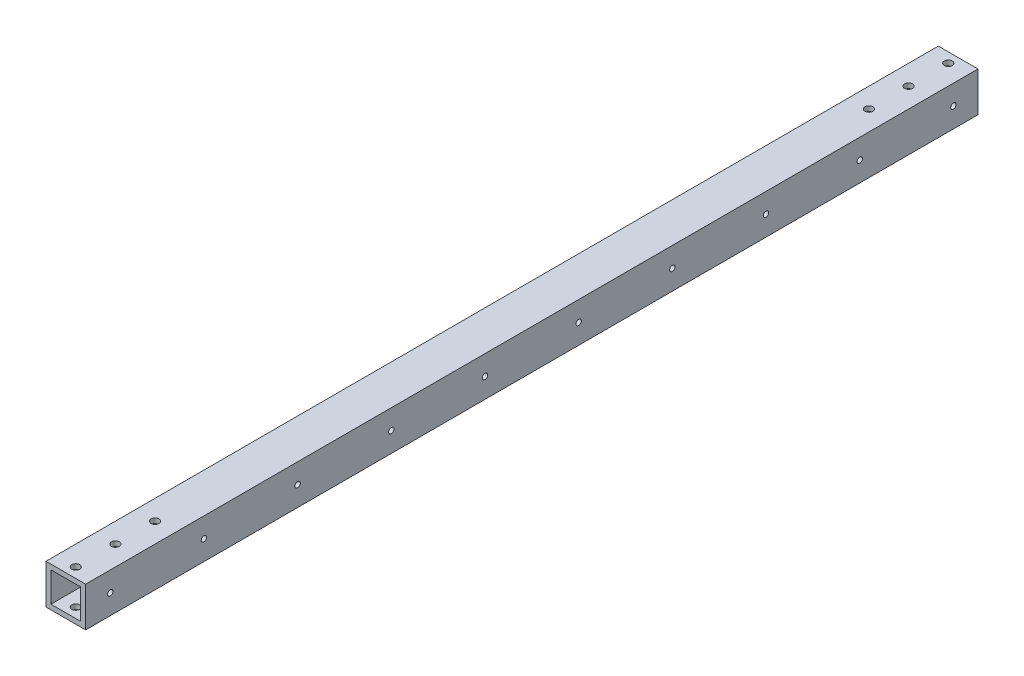
from build123d import *

# Parameters (mm, degrees)
SKETCH1_W                 = 25.4
SKETCH1_H                 = 25.4
SKETCH1_W_2               = 19.05
SKETCH1_H_2               = 19.05
EXTRUDE_THIN1_DEPTH       = 571.5
F_10_CLEARANCE_HOLE1_D    = 5.1054
F_8_32_TAPPED_HOLE1_D     = 3.4544
F_8_32_TAPPED_HOLE1_DEPTH = 10.70864
F_8_32_TAPPED_HOLE1_TIP   = 1.037806461


with BuildPart() as part:
    # Sketch1 → Extrude-Thin1 (new body)
    with BuildSketch(Plane.XY):
        Rectangle(SKETCH1_W, SKETCH1_H)
        Rectangle(SKETCH1_W_2, SKETCH1_H_2, mode=Mode.SUBTRACT)
    extrude(amount=EXTRUDE_THIN1_DEPTH)

    # #10 Clearance Hole1 (through all)
    with Locations(Plane(origin=(0, 12.7, 565.15), x_dir=(0, 0, 1), z_dir=(0, 1, 0))):
        with Locations((0, 0), (-558.8, 0), (-533.4, 0), (-508, 0), (-25.4, 0), (-50.8, 0)):
            Hole(F_10_CLEARANCE_HOLE1_D / 2)

    # #8-32 Tapped Hole1
    with Locations(Plane(origin=(12.7, 82.55, 285.75), x_dir=(0, 0, 1), z_dir=(1, 0, 0))):
        with Locations((-270, 82.55), (-210, 82.55), (-150, 82.55), (-30, 82.55), (30, 82.55), (90, 82.55), (150, 82.55), (210, 82.55), (270, 82.55), (-90, 82.55)):
            Hole(F_8_32_TAPPED_HOLE1_D / 2, depth=F_8_32_TAPPED_HOLE1_DEPTH)
            with Locations((0, 0, -(F_8_32_TAPPED_HOLE1_DEPTH + F_8_32_TAPPED_HOLE1_TIP / 2))):  # 118° drill point
                Cone(0, F_8_32_TAPPED_HOLE1_D / 2, F_8_32_TAPPED_HOLE1_TIP, mode=Mode.SUBTRACT)


solid = part.part
